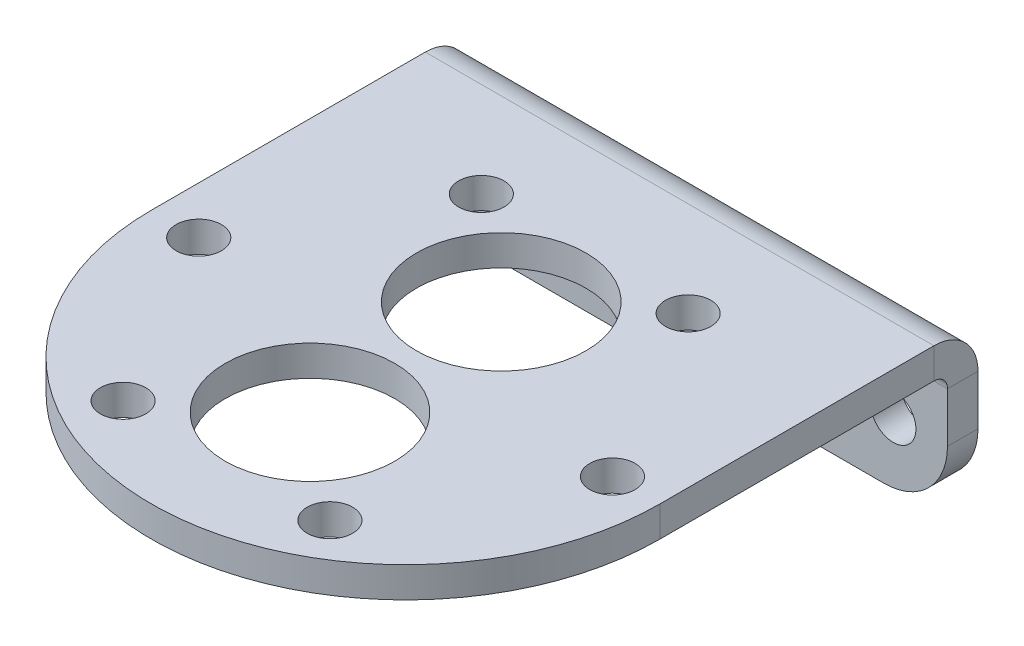
from build123d import *

# Parameters (mm, degrees)
BASE_FLANGIA_DEPTH            = 2.286
BORDO_FLANGIA_STRIP_W         = 11.176
BORDO_FLANGIA_STRIP_H         = 2.286
BORDO_FLANGIA_STRIP_CUT_DEPTH = 38.1
BORDO_FLANGIA_DEPTH           = 38.1
FORO_PER_VITE_M3_1_D          = 3.4
RIPETIZIONECIRCOLARE1_COUNT   = 6
SCHIZZO7_R                    = 6.35
TAGLIO_ESTRUSIONE1_DEPTH      = 2.54
FORO_PER_VITE_M3_2_D          = 3.4
RACCORDO_R                    = 4.7752


# Sheet-metal steps are written as plain solids
with BuildPart() as part:
    # Schizzo1 → Base-Flangia (new body)
    with BuildSketch(Plane(origin=(0, 0, 0), x_dir=(1, 0, 0), z_dir=(0, 1, 0))):
        with BuildLine():
            Line((19.05, 0), (19.05, 23.8252))
            Line((19.05, 23.8252), (-19.05, 23.8252))
            Line((-19.05, 23.8252), (-19.05, 0))
            ThreePointArc((-19.05, 0), (0, -19.05), (19.05, 0))
        make_face()
    extrude(amount=-BASE_FLANGIA_DEPTH)

    # Bordo-Flangia strip (across the edge) → Bordo-Flangia strip cut (cut)
    with BuildSketch(Plane(origin=(-19.05, -2.286, -23.8252), x_dir=(0, 0, 1), z_dir=(1, 0, 0))):
        with Locations((-2.286, -1.143)):
            Rectangle(BORDO_FLANGIA_STRIP_W, BORDO_FLANGIA_STRIP_H)
    extrude(amount=BORDO_FLANGIA_STRIP_CUT_DEPTH, mode=Mode.SUBTRACT)

    # Bordo-Flangia section (across the edge) → Bordo-Flangia (add)
    with BuildSketch(Plane(origin=(-19.05, -2.286, -23.8252), x_dir=(0, 0, 1), z_dir=(1, 0, 0))):
        with BuildLine():
            Line((0, 1.016), (0, 9.525))
            Line((0, 9.525), (2.286, 9.525))
            Line((2.286, 9.525), (2.286, 1.016))
            ThreePointArc((2.286, 1.016), (2.58357951, 0.29757951), (3.302, 0))
            Line((3.302, 0), (3.302, -2.286))
            ThreePointArc((3.302, -2.286), (0.967133409, -1.318866591), (0, 1.016))
        make_face()
    extrude(amount=BORDO_FLANGIA_DEPTH)

    # Foro per Vite M3-1 (through all)
    with Locations(Plane(origin=(0, 0, 0), x_dir=(1, 0, 0), z_dir=(0, 1, 0))):
        with Locations((15.494, 0)):
            foro_per_vite_m3_1 = Hole(FORO_PER_VITE_M3_1_D / 2)

    # RipetizioneCircolare1: Foro per Vite M3-1 ×6 about axis
    ripetizionecircolare1_axis = Axis((0, 0, 0), (0, 1, 0))
    for i in range(1, RIPETIZIONECIRCOLARE1_COUNT):
        add(foro_per_vite_m3_1.rotate(ripetizionecircolare1_axis, i * 360 / RIPETIZIONECIRCOLARE1_COUNT), mode=Mode.SUBTRACT)

    # Schizzo7 → Taglio-Estrusione1 (cut)
    with BuildSketch(Plane.XZ.offset(2.286)):
        with Locations(Location((0, -7.1628, 0), (0, 0, 270))):
            Circle(SCHIZZO7_R)
        with Locations(Location((0, 7.1628, 0), (0, 0, 270))):
            Circle(SCHIZZO7_R)
    extrude(amount=-TAGLIO_ESTRUSIONE1_DEPTH, mode=Mode.SUBTRACT)

    # Foro per Vite M3-2 (through all)
    with Locations(Plane(origin=(0, 0, -23.8252), x_dir=(1, 0, 0), z_dir=(0, 0, -1))):
        with Locations((14.986, 7.112), (-14.986, 7.112)):
            Hole(FORO_PER_VITE_M3_2_D / 2)

    # Raccordo
    raccordo_edges = [part.edges().sort_by_distance(p)[0] for p in [
        (-19.05, -11.811, -22.6822),
        (19.05, -11.811, -22.6822),
    ]]
    fillet(raccordo_edges, radius=RACCORDO_R)


solid = part.part
